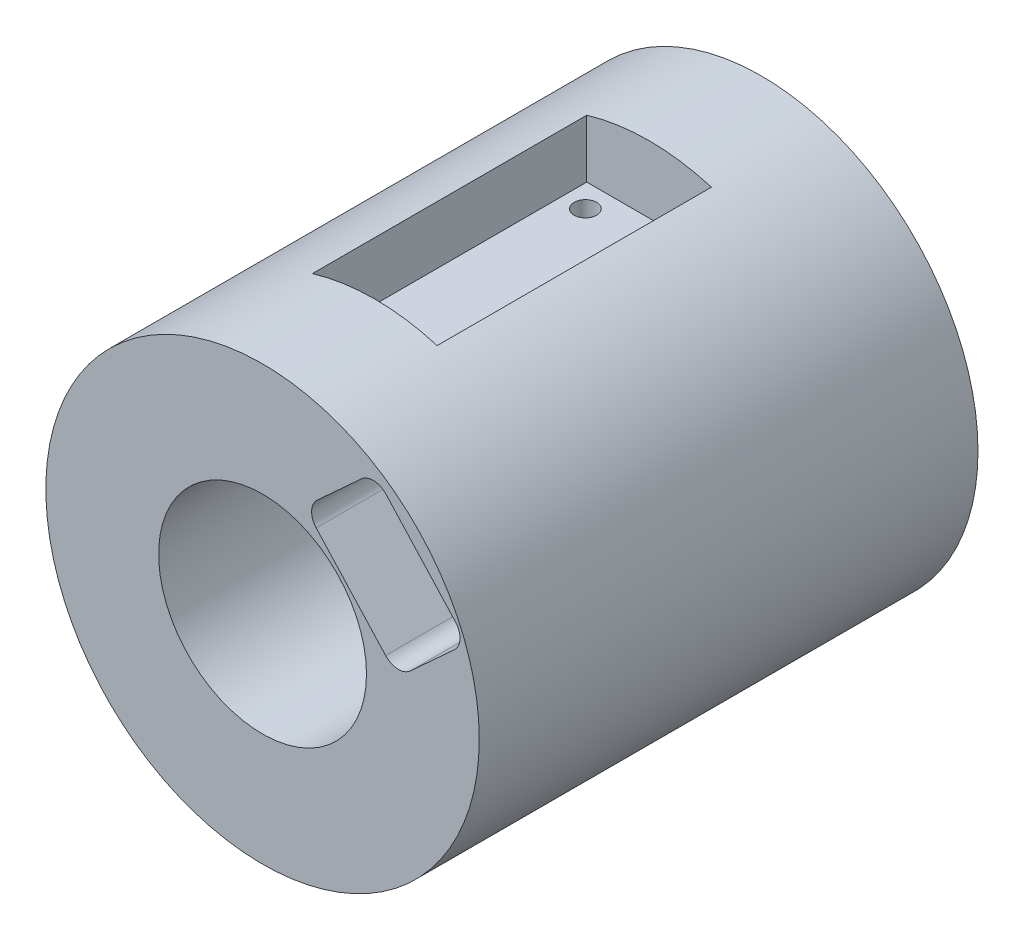
from build123d import *

# Parameters (mm, degrees)
ELECTRONICSBAYSKETCH_R      = 43.45
ELECTRONICSBAYSKETCH_R_2    = 20.8375
ELECTRONICSBAYEXTRUDE_DEPTH = 100
STRATOLOGGERSKETCH_W        = 25
STRATOLOGGERSKETCH_H        = 55
STRATOLOGGERCUT_DEPTH       = 132.464082547
HEATINSERTSKETCH_R          = 2.25
HEATINSERTCUT_DEPTH         = 6
CUT_EXTRUDE2_DEPTH          = 75


with BuildPart() as part:
    # ElectronicsBaySketch → ElectronicsBayExtrude (new body)
    with BuildSketch(Plane.XY):
        Circle(ELECTRONICSBAYSKETCH_R)
        Circle(ELECTRONICSBAYSKETCH_R_2, mode=Mode.SUBTRACT)
    extrude(amount=ELECTRONICSBAYEXTRUDE_DEPTH)

    # StratoLoggerSketch → StratoLoggerCut (cut, through all)
    with BuildSketch(Plane(origin=(0, 30, 0), x_dir=(1, 0, 0), z_dir=(0, 1, 0))):
        with Locations((0, -50)):
            Rectangle(STRATOLOGGERSKETCH_W, STRATOLOGGERSKETCH_H)
    extrude(amount=STRATOLOGGERCUT_DEPTH, mode=Mode.SUBTRACT)

    # HeatInsertSketch → HeatInsertCut (cut)
    with BuildSketch(Plane(origin=(0, 30, 0), x_dir=(1, 0, 0), z_dir=(0, 1, 0))):
        with Locations((-8.001, -27.267)):
            Circle(HEATINSERTSKETCH_R)
        with Locations((8.001, -27.267)):
            Circle(HEATINSERTSKETCH_R)
        with Locations((8.001, -72.733)):
            Circle(HEATINSERTSKETCH_R)
        with Locations((-8.001, -72.733)):
            Circle(HEATINSERTSKETCH_R)
    extrude(amount=-HEATINSERTCUT_DEPTH, mode=Mode.SUBTRACT)

    # Sketch4 → Cut-Extrude2 (cut)
    with BuildSketch(Plane.XY.offset(100)):
        with BuildLine():
            Line((19.817950497, 33.380511852), (10.970622456, 25.273429361))
            ThreePointArc((10.970622456, 25.273429361), (9.838519407, 22.845626538), (10.754717504, 20.328392955))
            Line((10.754717504, 20.328392955), (24.671875781, 5.140479817))
            ThreePointArc((24.671875781, 5.140479817), (27.099678604, 4.008376768), (29.616912186, 4.924574865))
            Line((29.616912186, 4.924574865), (38.464240228, 13.031657357))
            ThreePointArc((38.464240228, 13.031657357), (39.596343277, 15.45946018), (38.68014518, 17.976693762))
            Line((38.68014518, 17.976693762), (24.762986903, 33.1646069))
            ThreePointArc((24.762986903, 33.1646069), (22.33518408, 34.296709949), (19.817950497, 33.380511852))
        make_face()
    extrude(amount=-CUT_EXTRUDE2_DEPTH, mode=Mode.SUBTRACT)


solid = part.part
